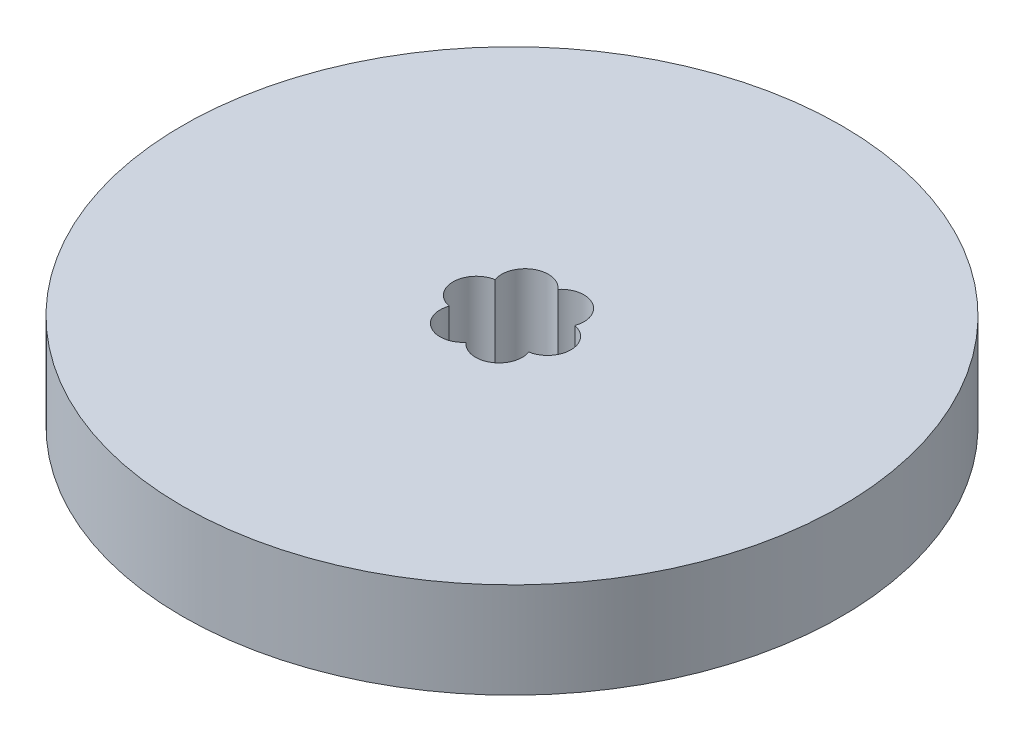
from build123d import *

# Parameters (mm, degrees)
SKETCH1_R           = 100
BOSS_EXTRUDE1_DEPTH = 29
SKETCH2_R           = 12.5
CUT_EXTRUDE1_DEPTH  = 145.364122967
SKETCH3_R           = 7.089633459
CUT_EXTRUDE2_DEPTH  = 24.608660531
CIRPATTERN1_COUNT   = 6


with BuildPart() as part:
    # Sketch1 → Boss-Extrude1 (new body)
    with BuildSketch(Plane(origin=(0, 0, 0), x_dir=(1, 0, 0), z_dir=(0, 1, 0))):
        Circle(SKETCH1_R)
    extrude(amount=BOSS_EXTRUDE1_DEPTH)

    # Sketch2 → Cut-Extrude1 (cut, through all)
    with BuildSketch(Plane(origin=(0, 0, 0), x_dir=(1, 0, 0), z_dir=(0, 1, 0))):
        Circle(SKETCH2_R)
    extrude(amount=CUT_EXTRUDE1_DEPTH, mode=Mode.SUBTRACT)

    # Sketch3 → Cut-Extrude2 (cut)
    with BuildSketch(Plane(origin=(0, 29, 0), x_dir=(1, 0, 0), z_dir=(0, 1, 0))):
        with Locations((-10.794655518, 0)):
            Circle(SKETCH3_R)
    cut_extrude2 = extrude(amount=-CUT_EXTRUDE2_DEPTH, mode=Mode.SUBTRACT)

    # CirPattern1: Cut-Extrude2 ×6 about axis
    cirpattern1_axis = Axis((0, 0, 0), (0, 1, 0))
    for i in range(1, CIRPATTERN1_COUNT):
        add(cut_extrude2.rotate(cirpattern1_axis, i * 360 / CIRPATTERN1_COUNT), mode=Mode.SUBTRACT)


solid = part.part
